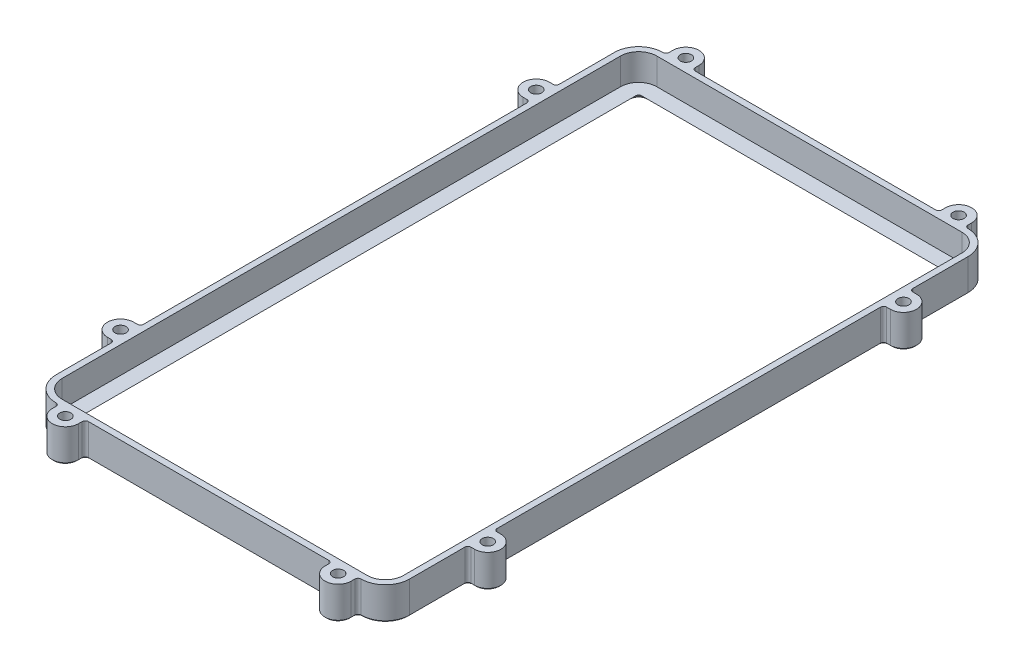
from build123d import *

# Parameters (mm, degrees)
BASE_DEPTH                      = 10.64
SHELL_T                         = -2
CLAMPS_DEPTH                    = 10.64
CLAMP_FILLETS_R                 = 1
FRAME_DEPTH                     = 2
FRAME_CHAMFER_SIZE              = 2
SKETCH23_R                      = 1.8
CLAMP_HOLES_DEPTH               = 192.436984887
SKETCH24_R                      = 2.9
CLAMP_COUNTERSINKS_DEPTH        = 3.4
CLAMP_COUNTERSINK_CHAMFERS_SIZE = 0.3
SHELL_CHAMFER_SIZE              = 0.5


with BuildPart() as part:
    # Sketch19 → Base (new body)
    with BuildSketch(Plane(origin=(0, 0, 0), x_dir=(-1, 0, 0), z_dir=(0, 1, 0))):
        with BuildLine():
            Line((-6.560267788, 44.869362099), (92.439732212, 44.869362099))
            ThreePointArc((92.439732212, 44.869362099), (98.011733648, 42.561363535), (100.319732212, 36.989362099))
            Line((100.319732212, 36.989362099), (100.319732212, -144.210637901))
            ThreePointArc((100.319732212, -144.210637901), (98.011733648, -149.782639336), (92.439732212, -152.090637901))
            Line((92.439732212, -152.090637901), (-6.560267788, -152.090637901))
            ThreePointArc((-6.560267788, -152.090637901), (-12.132269223, -149.782639336), (-14.440267788, -144.210637901))
            Line((-14.440267788, -144.210637901), (-14.440267788, 36.989362099))
            ThreePointArc((-14.440267788, 36.989362099), (-12.132269223, 42.561363535), (-6.560267788, 44.869362099))
        make_face()
    extrude(amount=BASE_DEPTH)

    # Shell
    shell_openings = [part.faces().sort_by_distance(p)[0] for p in [
        (-42.939732212, 10.64, -53.610637901),
        (-42.939732212, 0, -53.610637901),
    ]]
    offset(amount=SHELL_T, openings=shell_openings, kind=Kind.INTERSECTION)

    # Sketch22 → Clamps (add)
    with BuildSketch(Plane(origin=(0, 0, 0), x_dir=(-1, 0, 0), z_dir=(0, -1, 0))):
        with BuildLine():
            Line((-5.560267788, 154.290637901), (-5.560267788, 152.090637901))
            Line((-5.560267788, 152.090637901), (2.939732212, 152.090637901))
            Line((2.939732212, 152.090637901), (2.939732212, 154.290637901))
            ThreePointArc((2.939732212, 154.290637901), (-1.310267788, 158.540637901), (-5.560267788, 154.290637901))
        make_face()
        with BuildLine():
            Line((82.939732212, 154.290637901), (82.939732212, 152.090637901))
            Line((82.939732212, 152.090637901), (91.439732212, 152.090637901))
            Line((91.439732212, 152.090637901), (91.439732212, 154.290637901))
            ThreePointArc((91.439732212, 154.290637901), (87.189732212, 158.540637901), (82.939732212, 154.290637901))
        make_face()
        with BuildLine():
            Line((-5.560267788, -47.069362099), (-5.560267788, -44.869362099))
            Line((-5.560267788, -44.869362099), (2.939732212, -44.869362099))
            Line((2.939732212, -44.869362099), (2.939732212, -47.069362099))
            ThreePointArc((2.939732212, -47.069362099), (-1.310267788, -51.319362099), (-5.560267788, -47.069362099))
        make_face()
        with BuildLine():
            Line((82.939732212, -47.069362099), (82.939732212, -44.869362099))
            Line((82.939732212, -44.869362099), (91.439732212, -44.869362099))
            Line((91.439732212, -44.869362099), (91.439732212, -47.069362099))
            ThreePointArc((91.439732212, -47.069362099), (87.189732212, -51.319362099), (82.939732212, -47.069362099))
        make_face()
        with BuildLine():
            Line((-16.640267788, -18.089362099), (-14.440267788, -18.089362099))
            Line((-14.440267788, -18.089362099), (-14.440267788, -9.589362099))
            Line((-14.440267788, -9.589362099), (-16.640267788, -9.589362099))
            ThreePointArc((-16.640267788, -9.589362099), (-20.890267788, -13.839362099), (-16.640267788, -18.089362099))
        make_face()
        with BuildLine():
            Line((-16.640267788, 116.810637901), (-14.440267788, 116.810637901))
            Line((-14.440267788, 116.810637901), (-14.440267788, 125.310637901))
            Line((-14.440267788, 125.310637901), (-16.640267788, 125.310637901))
            ThreePointArc((-16.640267788, 125.310637901), (-20.890267788, 121.060637901), (-16.640267788, 116.810637901))
        make_face()
        with BuildLine():
            Line((102.519732212, 125.310637901), (100.319732212, 125.310637901))
            Line((100.319732212, 125.310637901), (100.319732212, 116.810637901))
            Line((100.319732212, 116.810637901), (102.519732212, 116.810637901))
            ThreePointArc((102.519732212, 116.810637901), (106.769732212, 121.060637901), (102.519732212, 125.310637901))
        make_face()
        with BuildLine():
            Line((100.319732212, -9.589362099), (102.519732212, -9.589362099))
            ThreePointArc((102.519732212, -9.589362099), (106.769732212, -13.839362099), (102.519732212, -18.089362099))
            Line((102.519732212, -18.089362099), (100.319732212, -18.089362099))
            Line((100.319732212, -18.089362099), (100.319732212, -9.589362099))
        make_face()
    extrude(amount=-CLAMPS_DEPTH)

    # Clamp Fillets
    clamp_fillets_edges = [part.edges().sort_by_distance(p)[0] for p in [
        (14.440267788, 5.32, -116.810637901),
        (14.440267788, 5.32, -125.310637901),
        (-100.319732212, 5.32, -125.310637901),
        (-100.319732212, 5.32, -116.810637901),
        (-100.319732212, 5.32, 9.589362099),
        (-100.319732212, 5.32, 18.089362099),
        (5.560267788, 5.32, -152.090637901),
        (-2.939732212, 5.32, -152.090637901),
        (-82.939732212, 5.32, -152.090637901),
        (-91.439732212, 5.32, -152.090637901),
        (-2.939732212, 5.32, 44.869362099),
        (5.560267788, 5.32, 44.869362099),
        (-91.439732212, 5.32, 44.869362099),
        (-82.939732212, 5.32, 44.869362099),
        (14.440267788, 5.32, 18.089362099),
        (14.440267788, 5.32, 9.589362099),
    ]]
    fillet(clamp_fillets_edges, radius=CLAMP_FILLETS_R - 0.0001)  # a hair under: the kernel refuses the full size

    # Sketch25 → Frame (add)
    with BuildSketch(Plane.XZ):
        with BuildLine():
            Line((14.440267788, -144.210637901), (14.440267788, -126.310637901))
            ThreePointArc((14.440267788, -126.310637901), (14.733161006, -125.603531119), (15.440267788, -125.310637901))
            Line((15.440267788, -125.310637901), (16.640267788, -125.310637901))
            ThreePointArc((16.640267788, -125.310637901), (20.890267788, -121.060637901), (16.640267788, -116.810637901))
            Line((16.640267788, -116.810637901), (15.440267788, -116.810637901))
            ThreePointArc((15.440267788, -116.810637901), (14.733161006, -116.517744682), (14.440267788, -115.810637901))
            Line((14.440267788, -115.810637901), (14.440267788, 8.589362099))
            ThreePointArc((14.440267788, 8.589362099), (14.733161006, 9.296468881), (15.440267788, 9.589362099))
            Line((15.440267788, 9.589362099), (16.640267788, 9.589362099))
            ThreePointArc((16.640267788, 9.589362099), (20.890267788, 13.839362099), (16.640267788, 18.089362099))
            Line((16.640267788, 18.089362099), (15.440267788, 18.089362099))
            ThreePointArc((15.440267788, 18.089362099), (14.733161006, 18.382255318), (14.440267788, 19.089362099))
            Line((14.440267788, 19.089362099), (14.440267788, 36.989362099))
            ThreePointArc((14.440267788, 36.989362099), (12.132269223, 42.561363535), (6.560267788, 44.869362099))
            ThreePointArc((6.560267788, 44.869362099), (5.853161006, 45.162255318), (5.560267788, 45.869362099))
            Line((5.560267788, 45.869362099), (5.560267788, 47.069362099))
            ThreePointArc((5.560267788, 47.069362099), (1.310267788, 51.319362099), (-2.939732212, 47.069362099))
            Line((-2.939732212, 47.069362099), (-2.939732212, 45.869362099))
            ThreePointArc((-2.939732212, 45.869362099), (-3.232625431, 45.162255318), (-3.939732212, 44.869362099))
            Line((-3.939732212, 44.869362099), (-81.939732212, 44.869362099))
            ThreePointArc((-81.939732212, 44.869362099), (-82.646838994, 45.162255318), (-82.939732212, 45.869362099))
            Line((-82.939732212, 45.869362099), (-82.939732212, 47.069362099))
            ThreePointArc((-82.939732212, 47.069362099), (-87.189732212, 51.319362099), (-91.439732212, 47.069362099))
            Line((-91.439732212, 47.069362099), (-91.439732212, 45.869362099))
            ThreePointArc((-91.439732212, 45.869362099), (-91.732625431, 45.162255318), (-92.439732212, 44.869362099))
            ThreePointArc((-92.439732212, 44.869362099), (-98.011733648, 42.561363535), (-100.319732212, 36.989362099))
            Line((-100.319732212, 36.989362099), (-100.319732212, 19.089362099))
            ThreePointArc((-100.319732212, 19.089362099), (-100.612625431, 18.382255318), (-101.319732212, 18.089362099))
            Line((-101.319732212, 18.089362099), (-102.519732212, 18.089362099))
            ThreePointArc((-102.519732212, 18.089362099), (-106.769732212, 13.839362099), (-102.519732212, 9.589362099))
            Line((-102.519732212, 9.589362099), (-101.319732212, 9.589362099))
            ThreePointArc((-101.319732212, 9.589362099), (-100.612625431, 9.296468881), (-100.319732212, 8.589362099))
            Line((-100.319732212, 8.589362099), (-100.319732212, -115.810637901))
            ThreePointArc((-100.319732212, -115.810637901), (-100.612625431, -116.517744682), (-101.319732212, -116.810637901))
            Line((-101.319732212, -116.810637901), (-102.519732212, -116.810637901))
            ThreePointArc((-102.519732212, -116.810637901), (-106.769732212, -121.060637901), (-102.519732212, -125.310637901))
            Line((-102.519732212, -125.310637901), (-101.319732212, -125.310637901))
            ThreePointArc((-101.319732212, -125.310637901), (-100.612625431, -125.603531119), (-100.319732212, -126.310637901))
            Line((-100.319732212, -126.310637901), (-100.319732212, -144.210637901))
            ThreePointArc((-100.319732212, -144.210637901), (-98.011733648, -149.782639336), (-92.439732212, -152.090637901))
            ThreePointArc((-92.439732212, -152.090637901), (-91.732625431, -152.383531119), (-91.439732212, -153.090637901))
            Line((-91.439732212, -153.090637901), (-91.439732212, -154.290637901))
            ThreePointArc((-91.439732212, -154.290637901), (-87.189732212, -158.540637901), (-82.939732212, -154.290637901))
            Line((-82.939732212, -154.290637901), (-82.939732212, -153.090637901))
            ThreePointArc((-82.939732212, -153.090637901), (-82.646838994, -152.383531119), (-81.939732212, -152.090637901))
            Line((-81.939732212, -152.090637901), (-3.939732212, -152.090637901))
            ThreePointArc((-3.939732212, -152.090637901), (-3.232625431, -152.383531119), (-2.939732212, -153.090637901))
            Line((-2.939732212, -153.090637901), (-2.939732212, -154.290637901))
            ThreePointArc((-2.939732212, -154.290637901), (1.310267788, -158.540637901), (5.560267788, -154.290637901))
            Line((5.560267788, -154.290637901), (5.560267788, -153.090637901))
            ThreePointArc((5.560267788, -153.090637901), (5.853161006, -152.383531119), (6.560267788, -152.090637901))
            ThreePointArc((6.560267788, -152.090637901), (12.132269223, -149.782639336), (14.440267788, -144.210637901))
        make_face()
        with BuildLine():
            Line((6.560267788, 37.869362099), (-92.439732212, 37.869362099))
            ThreePointArc((-92.439732212, 37.869362099), (-93.06198618, 37.611616067), (-93.319732212, 36.989362099))
            Line((-93.319732212, 36.989362099), (-93.319732212, -144.210637901))
            ThreePointArc((-93.319732212, -144.210637901), (-93.06198618, -144.832891868), (-92.439732212, -145.090637901))
            Line((-92.439732212, -145.090637901), (6.560267788, -145.090637901))
            ThreePointArc((6.560267788, -145.090637901), (7.182521755, -144.832891868), (7.440267788, -144.210637901))
            Line((7.440267788, -144.210637901), (7.440267788, 36.989362099))
            ThreePointArc((7.440267788, 36.989362099), (7.182521755, 37.611616067), (6.560267788, 37.869362099))
        make_face(mode=Mode.SUBTRACT)
    extrude(amount=-FRAME_DEPTH)

    # Frame Chamfer
    frame_chamfer_edges = [part.edges().sort_by_distance(p)[0] for p in [
        (-42.939732212, 0, 37.869362099),
        (7.440267788, 0, -53.610637901),
        (-42.939732212, 0, -145.090637901),
        (-93.319732212, 0, -53.610637901),
        (7.182521755, 0, 37.611616067),
        (7.182521755, 0, -144.832891868),
        (-93.06198618, 0, 37.611616067),
        (-93.06198618, 0, -144.832891868),
    ]]
    chamfer(frame_chamfer_edges, length=FRAME_CHAMFER_SIZE - 0.0001)  # a hair under: the kernel refuses the full size

    # Sketch23 → Clamp Holes (cut, through all)
    with BuildSketch(Plane(origin=(0, 0, 0), x_dir=(-1, 0, 0), z_dir=(0, -1, 0))):
        with Locations(Location((-1.310267788, 154.290637901, 0), (0, 0, 90))):
            Circle(SKETCH23_R)
        with Locations(Location((87.189732212, 154.290637901, 0), (0, 0, 90))):
            Circle(SKETCH23_R)
        with Locations(Location((-1.310267788, -47.069362099, 0), (0, 0, 90))):
            Circle(SKETCH23_R)
        with Locations(Location((87.189732212, -47.069362099, 0), (0, 0, 90))):
            Circle(SKETCH23_R)
        with Locations(Location((-16.640267788, 121.060637901, 0), (0, 0, 90))):
            Circle(SKETCH23_R)
        with Locations(Location((102.519732212, 121.060637901, 0), (0, 0, 90))):
            Circle(SKETCH23_R)
        with Locations(Location((102.519732212, -13.839362099, 0), (0, 0, 90))):
            Circle(SKETCH23_R)
        with Locations(Location((-16.640267788, -13.839362099, 0), (0, 0, 90))):
            Circle(SKETCH23_R)
    extrude(amount=-CLAMP_HOLES_DEPTH, mode=Mode.SUBTRACT)

    # Sketch24 → Clamp Countersinks (cut)
    with BuildSketch(Plane.XZ):
        with Locations(Location((-87.189732212, 47.069362099, 0), (0, 0, 270))):
            Circle(SKETCH24_R)
        with Locations(Location((1.310267788, 47.069362099, 0), (0, 0, 270))):
            Circle(SKETCH24_R)
        with Locations(Location((1.310267788, -154.290637901, 0), (0, 0, 270))):
            Circle(SKETCH24_R)
        with Locations(Location((-87.189732212, -154.290637901, 0), (0, 0, 270))):
            Circle(SKETCH24_R)
        with Locations(Location((16.640267788, -121.060637901, 0), (0, 0, 270))):
            Circle(SKETCH24_R)
        with Locations(Location((-102.519732212, -121.060637901, 0), (0, 0, 270))):
            Circle(SKETCH24_R)
        with Locations(Location((-102.519732212, 13.839362099, 0), (0, 0, 270))):
            Circle(SKETCH24_R)
        with Locations(Location((16.640267788, 13.839362099, 0), (0, 0, 270))):
            Circle(SKETCH24_R)
    extrude(amount=-CLAMP_COUNTERSINKS_DEPTH, mode=Mode.SUBTRACT)

    # Clamp Countersink Chamfers
    clamp_countersink_chamfers_edges = [part.edges().sort_by_distance(p)[0] for p in [
        (-87.189732212, 0, -151.390637901),
        (1.310267788, 0, -151.390637901),
        (1.310267788, 0, 49.969362099),
        (-87.189732212, 0, 49.969362099),
    ]]
    chamfer(clamp_countersink_chamfers_edges, length=CLAMP_COUNTERSINK_CHAMFERS_SIZE)

    # Shell Chamfer
    shell_chamfer_edges = [part.edges().sort_by_distance(p)[0] for p in [
        (20.890267788, 0, -121.060637901),
        (16.040217788, 0, -116.810637901),
        (12.132269223, 0, -149.782639336),
        (-106.769732212, 0, -121.060637901),
        (-101.919682212, 0, -125.310637901),
        (-106.769732212, 0, 13.839362099),
        (-101.919682212, 0, 9.589362099),
        (-100.319732212, 0, 28.039312099),
        (-101.919682212, 0, 18.089362099),
        (-100.319732212, 0, -53.610637901),
        (-101.919682212, 0, -116.810637901),
        (14.440267788, 0, -135.260587901),
        (16.040217788, 0, -125.310637901),
        (14.440267788, 0, -53.610637901),
        (16.040217788, 0, 9.589362099),
        (-42.939732212, 0, 44.869362099),
        (-82.939732212, 0, 46.469312099),
        (5.560267788, 0, 46.469312099),
        (-42.939732212, 0, -152.090637901),
        (-2.939732212, 0, -153.690587901),
        (-91.439732212, 0, -153.690587901),
        (-100.612625431, 0, 18.382255318),
        (-100.612625431, 0, -116.517744682),
        (-100.612625431, 0, -125.603531119),
        (-100.612625431, 0, 9.296468881),
        (14.733161006, 0, -125.603531119),
        (14.733161006, 0, 9.296468881),
        (14.733161006, 0, -116.517744682),
        (14.733161006, 0, 18.382255318),
        (-82.646838994, 0, 45.162255318),
        (5.853161006, 0, 45.162255318),
        (-3.232625431, 0, 45.162255318),
        (-91.732625431, 0, 45.162255318),
        (-3.232625431, 0, -152.383531119),
        (-91.732625431, 0, -152.383531119),
        (-82.646838994, 0, -152.383531119),
        (5.853161006, 0, -152.383531119),
        (1.310267788, 0, -158.540637901),
        (5.560267788, 0, -153.690587901),
        (-87.189732212, 0, -158.540637901),
        (-82.939732212, 0, -153.690587901),
        (1.310267788, 0, 51.319362099),
        (-2.939732212, 0, 46.469312099),
        (14.440267788, 0, 28.039312099),
        (12.132269223, 0, 42.561363535),
        (-87.189732212, 0, 51.319362099),
        (-91.439732212, 0, 46.469312099),
        (-98.011733648, 0, 42.561363535),
        (20.890267788, 0, 13.839362099),
        (16.040217788, 0, 18.089362099),
        (-100.319732212, 0, -135.260587901),
        (-98.011733648, 0, -149.782639336),
    ]]
    chamfer(shell_chamfer_edges, length=SHELL_CHAMFER_SIZE)


solid = part.part
